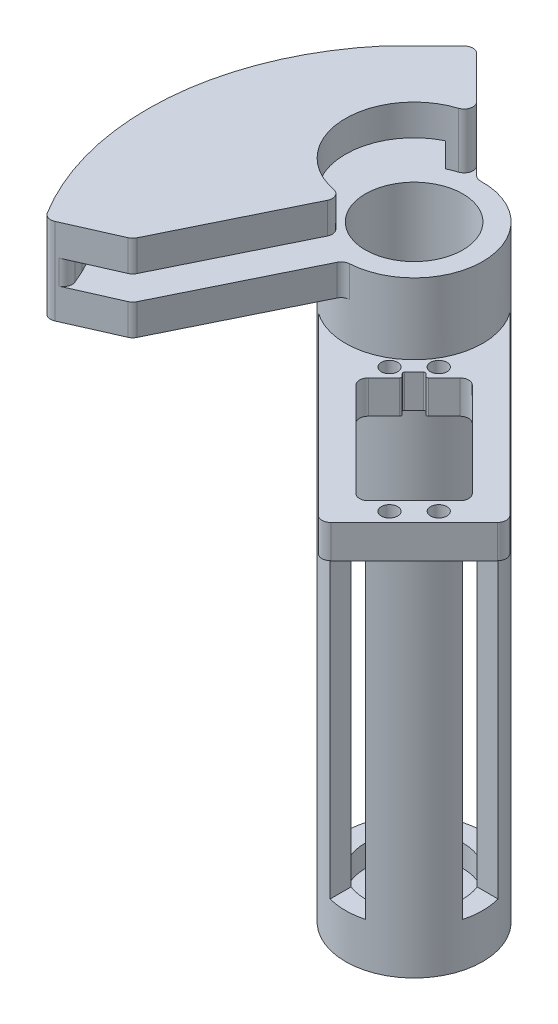
from build123d import *
from build123d.topology import SkipClean

# Parameters (mm, degrees)
SKETCH1_R                            = 19.685
SKETCH1_R_2                          = 13.97
BOSS_EXTRUDE1_DEPTH                  = 173.99
SKETCH2_R                            = 13.97
BOSS_EXTRUDE2_DEPTH                  = 6.35
SKETCH7_R                            = 6.35
CUT_EXTRUDE4_DEPTH                   = 170.935776251
SKETCH9_W                            = 38.862
SKETCH9_H                            = 9.525
BOSS_EXTRUDE3_DEPTH                  = 6.35
BOSS_EXTRUDE3_DIRECTION_2_REACH      = 182.364
BOSS_EXTRUDE3_DIRECTION_2_END_RADIUS = 19.685
SKETCH10_W                           = 7.62
SKETCH10_H                           = 9.525
BOSS_EXTRUDE4_DEPTH                  = 50.8
BOSS_EXTRUDE5_REACH                  = 201.196
SKETCH11_W                           = 7.62
SKETCH11_H                           = 9.525
FILLET1_R                            = 2.54
CUT_EXTRUDE7_REACH                   = 182.524
SKETCH12_R                           = 2.35585
CUT_EXTRUDE9_REACH                   = 182.524
FILLET5_R                            = 0.508
BOSS_EXTRUDE6_DEPTH                  = 15.875
BOSS_EXTRUDE6_DEPTH_BACK             = 8.89
CUT_EXTRUDE10_DEPTH                  = 6.985
CUT_EXTRUDE11_DEPTH                  = 6.985
FILLET7_R                            = 2.54
FILLET8_R                            = 2.54
FILLET9_R                            = 2.54
CUT_EXTRUDE12_DEPTH                  = 213.353464491
CUT_EXTRUDE12_DEPTH_BACK             = 213.353464491
SKETCH5_W                            = 10.16
SKETCH5_H                            = 25.4
SKETCH5_H_2                          = 76.2
CUT_EXTRUDE13_DEPTH                  = 213.353464491
CUT_EXTRUDE13_DEPTH_BACK             = 213.353464491
SKETCH8_W                            = 10.16
SKETCH8_H                            = 25.4
SKETCH8_H_2                          = 76.2


with BuildPart() as part:
    # Sketch1 → Boss-Extrude1 (new body)
    with BuildSketch(Plane(origin=(0, 0, 0), x_dir=(1, 0, 0), z_dir=(0, 1, 0))):
        with Locations(Location((0, 0, 0), (0, 0, 270))):
            Circle(SKETCH1_R)
        with Locations(Location((0, 0, 0), (0, 0, 270))):
            Circle(SKETCH1_R_2, mode=Mode.SUBTRACT)
    extrude(amount=BOSS_EXTRUDE1_DEPTH)

    # Sketch2 → Boss-Extrude2 (add)
    with BuildSketch(Plane.XZ):
        with Locations(Location((0, 0, 0), (0, 0, 270))):
            Circle(SKETCH2_R)
    extrude(amount=-BOSS_EXTRUDE2_DEPTH)

    # Sketch7 → Cut-Extrude4 (cut, through all)
    with BuildSketch(Plane(origin=(0, 6.35, 0), x_dir=(1, 0, 0), z_dir=(0, 1, 0))):
        with Locations(Location((0, 0, 0), (0, 0, 270))):
            Circle(SKETCH7_R)
    extrude(amount=-CUT_EXTRUDE4_DEPTH, mode=Mode.SUBTRACT)

    # Sketch9 → Boss-Extrude3 (add)
    with BuildSketch(Plane(origin=(13.919396988, 0, 13.919396988), x_dir=(0.7071067811865476, 0, -0.7071067811865476), z_dir=(0.7071067811865476, 0, 0.7071067811865476))):
        with Locations((0, 148.8795)):
            Rectangle(SKETCH9_W, SKETCH9_H)
    extrude(amount=BOSS_EXTRUDE3_DEPTH)

    # Boss-Extrude3 direction 2: up to this cylinder (the profile starts outside it)
    boss_extrude3_direction_2_end = Plane(origin=(0, 148.8795, 0), z_dir=(0, -1, 0)) * Cylinder(BOSS_EXTRUDE3_DIRECTION_2_END_RADIUS, 405.098, mode=Mode.PRIVATE)
    # Sketch9 → Boss-Extrude3 direction 2 (add, up to the surface)
    with BuildSketch(Plane(origin=(13.919396988, 0, 13.919396988), x_dir=(0.7071067811865476, 0, -0.7071067811865476), z_dir=(0.7071067811865476, 0, 0.7071067811865476)), mode=Mode.PRIVATE) as boss_extrude3_direction_2_sk1:
        with Locations((0, 148.8795)):
            Rectangle(SKETCH9_W, SKETCH9_H)
    boss_extrude3_direction_2_tool1 = extrude(boss_extrude3_direction_2_sk1.sketch, amount=-BOSS_EXTRUDE3_DIRECTION_2_REACH, mode=Mode.PRIVATE) - boss_extrude3_direction_2_end
    add(boss_extrude3_direction_2_tool1.solids().sort_by_distance((13.919397, 148.8795, 13.919397))[0])
    add(boss_extrude3_direction_2_tool1.solids().sort_by_distance((13.919397, 148.8795, 13.919397))[1])

    # Sketch10 → Boss-Extrude4 (add)
    with BuildSketch(Plane(origin=(18.409525048, 0, 18.409525048), x_dir=(0.7071067811865481, 0, -0.707106781186547), z_dir=(0.707106781186547, 0, 0.7071067811865481))):
        with Locations((-15.621, 148.8795)):
            Rectangle(SKETCH10_W, SKETCH10_H)
        with Locations((15.621, 148.8795)):
            Rectangle(SKETCH10_W, SKETCH10_H)
    extrude(amount=BOSS_EXTRUDE4_DEPTH)

    # Sketch11 → Boss-Extrude5 (add, up to next)
    with BuildSketch(Plane(origin=(-8.351638193, 0, 8.351638193), x_dir=(-0.7071067811865471, 0, -0.7071067811865479), z_dir=(0.7071067811865479, 0, -0.7071067811865471)), mode=Mode.PRIVATE) as boss_extrude5_sk1:
        with Locations((-73.025, 148.8795)):
            Rectangle(SKETCH11_W, SKETCH11_H)
    boss_extrude5_tool1 = extrude(boss_extrude5_sk1.sketch, amount=BOSS_EXTRUDE5_REACH, mode=Mode.PRIVATE) - part.part
    add(boss_extrude5_tool1.solids().sort_by_distance((43.284835, 148.8795, 59.988111))[0])

    # Fillet1
    fillet1_edges = [part.edges().sort_by_distance(p)[0] for p in [
        (10.057886856, 148.8795, 26.761163241),
        (40.590757667, 148.8795, 68.070341398),
        (26.761163241, 148.8795, 10.057886856),
        (68.070341398, 148.8795, 40.590757667),
        (57.294034052, 148.8795, 40.590757667),
        (40.590757667, 148.8795, 57.294034052),
    ]]
    fillet(fillet1_edges, radius=FILLET1_R)

    # Sketch12 → Cut-Extrude7 (cut, up to next)
    with BuildSketch(Plane(origin=(0, 153.642, 0), x_dir=(1, 0, 0), z_dir=(0, 1, 0)), mode=Mode.PRIVATE) as cut_extrude7_sk1:
        with Locations(Location((48.033763646, -55.104831458, 0), (0, 0, 270))):
            Circle(SKETCH12_R)
    cut_extrude7_tool1 = extrude(cut_extrude7_sk1.sketch, amount=-CUT_EXTRUDE7_REACH, mode=Mode.PRIVATE) & part.part
    # Sketch12 → Cut-Extrude7 (cut, up to next)
    with BuildSketch(Plane(origin=(0, 153.642, 0), x_dir=(1, 0, 0), z_dir=(0, 1, 0)), mode=Mode.PRIVATE) as cut_extrude7_sk2:
        with Locations(Location((55.104831458, -48.033763646, 0), (0, 0, 270))):
            Circle(SKETCH12_R)
    cut_extrude7_tool2 = extrude(cut_extrude7_sk2.sketch, amount=-CUT_EXTRUDE7_REACH, mode=Mode.PRIVATE) & part.part
    # Sketch12 → Cut-Extrude7 (cut, up to next)
    with BuildSketch(Plane(origin=(0, 153.642, 0), x_dir=(1, 0, 0), z_dir=(0, 1, 0)), mode=Mode.PRIVATE) as cut_extrude7_sk3:
        with Locations(Location((19.254517652, -12.18344984, 0), (0, 0, 270))):
            Circle(SKETCH12_R)
    cut_extrude7_tool3 = extrude(cut_extrude7_sk3.sketch, amount=-CUT_EXTRUDE7_REACH, mode=Mode.PRIVATE) & part.part
    # Sketch12 → Cut-Extrude7 (cut, up to next)
    with BuildSketch(Plane(origin=(0, 153.642, 0), x_dir=(1, 0, 0), z_dir=(0, 1, 0)), mode=Mode.PRIVATE) as cut_extrude7_sk4:
        with Locations(Location((12.18344984, -19.254517652, 0), (0, 0, 270))):
            Circle(SKETCH12_R)
    cut_extrude7_tool4 = extrude(cut_extrude7_sk4.sketch, amount=-CUT_EXTRUDE7_REACH, mode=Mode.PRIVATE) & part.part
    add(cut_extrude7_tool1.solids().sort_by_distance((48.033764, 153.642, 55.104831))[0], mode=Mode.SUBTRACT)
    add(cut_extrude7_tool2.solids().sort_by_distance((55.104831, 153.642, 48.033764))[0], mode=Mode.SUBTRACT)
    add(cut_extrude7_tool3.solids().sort_by_distance((19.254518, 153.642, 12.18345))[0], mode=Mode.SUBTRACT)
    add(cut_extrude7_tool4.solids().sort_by_distance((12.18345, 153.642, 19.254518))[0], mode=Mode.SUBTRACT)

    # Sketch22 → Cut-Extrude9 (cut, up to next)
    with BuildSketch(Plane(origin=(0, 153.642, 0), x_dir=(1, 0, 0), z_dir=(0, 1, 0)), mode=Mode.PRIVATE) as cut_extrude9_sk1:
        Polygon((16.703276385, -20.115773711), (20.115773711, -16.703276385), (18.678932732, -15.266435406), (15.266435406, -18.678932732), align=None)
    cut_extrude9_tool1 = extrude(cut_extrude9_sk1.sketch, amount=-CUT_EXTRUDE9_REACH, mode=Mode.PRIVATE) & part.part
    add(cut_extrude9_tool1.solids().sort_by_distance((17.691105, 153.642, 17.691105))[0], mode=Mode.SUBTRACT)

    # Fillet5
    fillet5_edges = [part.edges().sort_by_distance(p)[0] for p in [
        (16.703276385, 148.8795, 20.115773711),
        (15.266435406, 148.8795, 18.678932732),
        (18.678932732, 148.8795, 15.266435406),
        (20.115773711, 148.8795, 16.703276385),
    ]]
    fillet(fillet5_edges, radius=FILLET5_R)

    # Sketch24 → Boss-Extrude6 (add, two sides: drawn at the far end of the back side and taken through both)
    with BuildSketch(Plane(origin=(0, 173.99, 0), x_dir=(1, 0, 0), z_dir=(0, 1, 0)).offset(-BOSS_EXTRUDE6_DEPTH_BACK)):
        with BuildLine():
            Line((-1.654809111, 19.615321354), (-18.858537854, 36.819050096))
            Line((-18.858537854, 36.819050096), (-32.328922036, 23.348665915))
            ThreePointArc((-32.328922036, 23.348665915), (-50.285766243, -21.490686658), (-37.785478501, -68.146432278))
            Line((-37.785478501, -68.146432278), (-20.362192025, -60.443732207))
            Line((-20.362192025, -60.443732207), (-0.348920906, -19.681907408))
            ThreePointArc((-0.348920906, -19.681907408), (-19.674139894, -0.653792342), (-1.654809111, 19.615321354))
        make_face()
    extrude(amount=BOSS_EXTRUDE6_DEPTH + BOSS_EXTRUDE6_DEPTH_BACK)

    # Sketch25 → Cut-Extrude10 (cut)
    with BuildSketch(Plane(origin=(0, 173.99, 0), x_dir=(1, 0, 0), z_dir=(0, 1, 0))):
        with BuildLine():
            ThreePointArc((-27.647974301, 19.049357529), (-43.749813849, -19.335310427), (-35.25310949, -60.084028026))
            Line((-35.25310949, -60.084028026), (-22.929758715, -54.635970049))
            Line((-22.929758715, -54.635970049), (-16.008337298, -51.576063222))
            Line((-16.008337298, -51.576063222), (-0.348920906, -19.681907408))
            ThreePointArc((-0.348920906, -19.681907408), (-19.212220786, -4.288332714), (-8.685165579, 17.665421701))
            Line((-8.685165579, 17.665421701), (-18.858537854, 27.838793975))
            Line((-18.858537854, 27.838793975), (-27.647974301, 19.049357529))
        make_face()
    extrude(amount=CUT_EXTRUDE10_DEPTH, mode=Mode.SUBTRACT)

    # Sketch25<3> → Cut-Extrude11 (cut)
    with BuildSketch(Plane(origin=(0, 173.99, 0), x_dir=(1, 0, 0), z_dir=(0, 1, 0))):
        Polygon((-22.929758715, -54.635970049), (-35.25310949, -60.084028026), (-32.6855428, -65.891790185), (-20.362192025, -60.443732207), (-16.008337298, -51.576063222), align=None)
    extrude(amount=CUT_EXTRUDE11_DEPTH, mode=Mode.SUBTRACT)

    # Fillet7
    # the kernel refuses this fillet: 2.54 mm, written as the material it adds along each edge
    with BuildSketch(Plane(origin=(-0.348920906, 173.99, 19.681907408), x_dir=(0.9998145543990907, 0, -0.01925764294371538), z_dir=(0, -1, 0))) as fillet7_piece_1:
        with BuildLine():
            CenterArc((1.549687123, 2.538262979), FILLET7_R, 207.253599252, 60.627317533)
            Line((-0.708343353, 1.375121386), (0, 0))
            ThreePointArc((0, 0), (0.727883346, 0.01346191), (1.455766692, 0))
        make_face()
    extrude(amount=8.89)
    with BuildSketch(Plane(origin=(-18.858537854, 167.64, -27.838793975), x_dir=(-0.7071067811865475, 0, 0.7071067811865475), z_dir=(0, 1, 0))) as fillet7_piece_2:
        with BuildLine():
            CenterArc((FILLET7_R, FILLET7_R), FILLET7_R, 180, 90)
            Line((0, FILLET7_R), (0, 0))
            Line((0, 0), (FILLET7_R, 0))
        make_face()
    extrude(amount=19.685)
    # the kernel refuses this fillet: 2.54 mm, written as the material it takes off along each edge
    with BuildSketch(Plane(origin=(-0.348920906, 198.935116734, 19.681907408), x_dir=(-0.4407250194044606, 0, 0.8976421654929864), z_dir=(0, -1, 0))) as fillet7_2_piece_1_section:
        with BuildLine():
            CenterArc((3.628046694, 2.54), FILLET7_R, 164.816165864, 105.183834136)
            ThreePointArc((1.176716996, 3.205268904), (0.657985503, 1.577073014), (0, 0))
            Line((0, 0), (3.628046694, 0))
        make_face()
    fillet7_2_piece_1 = extrude(amount=27.030233469, mode=Mode.PRIVATE)
    fillet7_2_piece_1 = split(fillet7_2_piece_1, bisect_by=Plane(origin=(-1.547722255, 173.99, 20.415645586), z_dir=(0, 1, 0)), keep=Keep.TOP, mode=Mode.PRIVATE)
    add(fillet7_2_piece_1, mode=Mode.SUBTRACT)
    with BuildSketch(Plane(origin=(-37.785478501, 159.558530429, 68.146432278), x_dir=(-0.5384763243852061, 0, -0.8426406399388758), z_dir=(0, 1, 0))) as fillet7_2_piece_2:
        with BuildLine():
            CenterArc((2.179772309, -2.539733178), FILLET7_R, 89.169508748, 82.100366111)
            Line((-0.33079981, -2.154210626), (0, 0))
            ThreePointArc((0, 0), (1.108293914, 0.008032394), (2.216587829, 0))
        make_face()
    extrude(amount=35.847939143, mode=Mode.SUBTRACT)
    with BuildSketch(Plane(origin=(-20.362192025, 192.176210988, 60.443732207), x_dir=(-0.9146082139693783, 0, 0.40434121103313725), z_dir=(0, -1, 0)), Plane(origin=(-20.362192025, 176.301210988, 60.443732207), x_dir=(-0.9146082139693783, 0, 0.40434121103313725), z_dir=(0, -1, 0))) as fillet7_2_piece_3:
        with BuildLine():
            CenterArc((FILLET7_R * 0.363970234266, FILLET7_R), FILLET7_R, 230, 40)
            Line((-FILLET7_R * 0.27881737542, FILLET7_R * 0.233955556881), (0, 0))
            Line((0, 0), (FILLET7_R * 0.363970234266, 0))
        make_face()
    extrude(amount=13.512421975, mode=Mode.SUBTRACT)
    with BuildSketch(Plane(origin=(-32.6855428, 173.99, 65.891790185), x_dir=(-0.9146082139693789, 0, 0.4043412110331356), z_dir=(0, 1, 0))) as fillet7_2_piece_4:
        with BuildLine():
            CenterArc((FILLET7_R, -FILLET7_R), FILLET7_R, 90, 90)
            Line((0, -FILLET7_R), (0, 0))
            Line((0, 0), (FILLET7_R, 0))
        make_face()
    extrude(amount=6.985, mode=Mode.SUBTRACT)

    # Fillet8
    fillet8_edges = [part.edges().sort_by_distance(p)[0] for p in [
        (-1.654809111, 181.9275, -19.615321354),
        (-18.858537854, 177.4825, -36.819050096),
    ]]
    fillet(fillet8_edges, radius=FILLET8_R)

    # Fillet9
    fillet9_edges = [part.edges().sort_by_distance(p)[0] for p in [
        (-1.654809111, 169.545, -19.615321354),
    ]]
    fillet(fillet9_edges, radius=FILLET9_R)

    # Sketch5 → Cut-Extrude12 (cut, two sides: drawn at the far end of the back side and taken through both)
    with SkipClean():  # the faces are left unmerged after this step: merging them gives an invalid solid
        with BuildSketch(Plane(origin=(0, 0, 0), x_dir=(0, 0, -1), z_dir=(1, 0, 0)).offset(-CUT_EXTRUDE12_DEPTH_BACK)):
            with Locations((0, 101.6)):
                Rectangle(SKETCH5_W, SKETCH5_H)
            with Locations((0, 50.8)):
                Rectangle(SKETCH5_W, SKETCH5_H_2)
        extrude(amount=CUT_EXTRUDE12_DEPTH + CUT_EXTRUDE12_DEPTH_BACK, mode=Mode.SUBTRACT)

    # Sketch8 → Cut-Extrude13 (cut, two sides: drawn at the far end of the back side and taken through both)
    with SkipClean():  # the faces are left unmerged after this step: merging them gives an invalid solid
        with BuildSketch(Plane.XY.offset(-CUT_EXTRUDE13_DEPTH_BACK)):
            with Locations((0, 101.6)):
                Rectangle(SKETCH8_W, SKETCH8_H)
            with Locations((0, 50.8)):
                Rectangle(SKETCH8_W, SKETCH8_H_2)
        extrude(amount=CUT_EXTRUDE13_DEPTH + CUT_EXTRUDE13_DEPTH_BACK, mode=Mode.SUBTRACT)


solid = part.part
